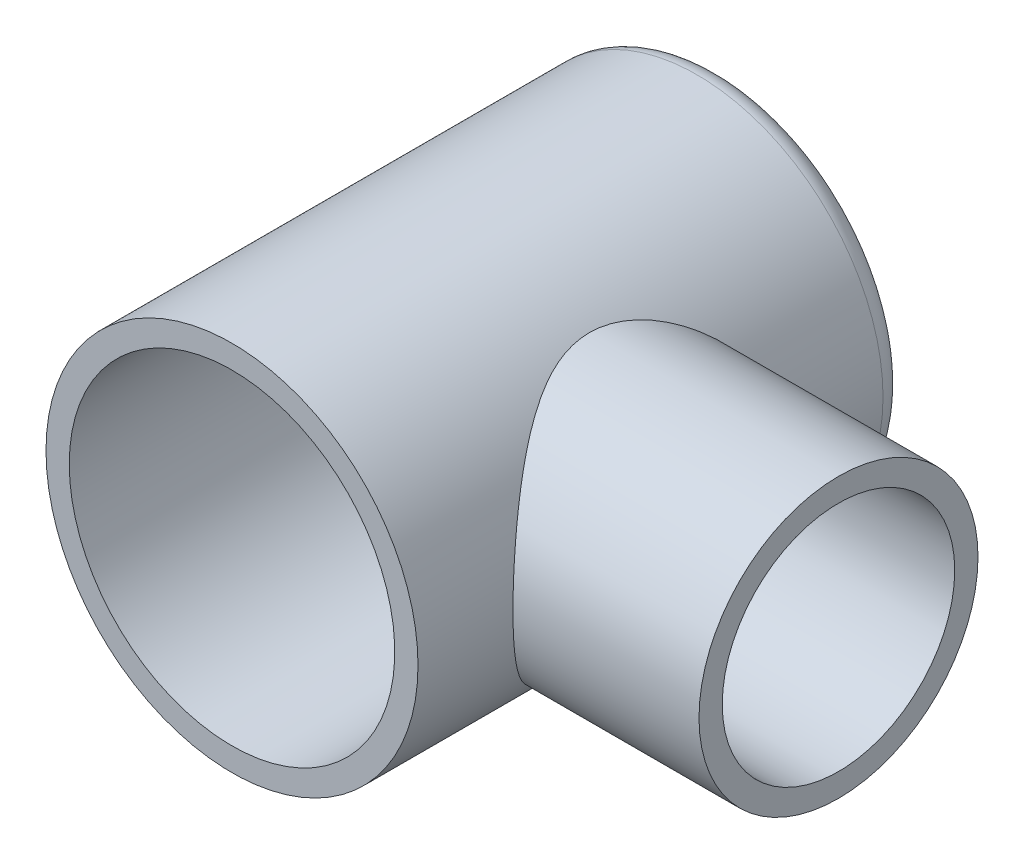
from build123d import *

# Parameters (mm, degrees)
SKETCH2_R                = 4
SKETCH2_R_2              = 3.5
BOSS_EXTRUDE1_DEPTH      = 10
BOSS_EXTRUDE2_REACH      = 15.601
BOSS_EXTRUDE2_END_RADIUS = 4
SKETCH3_R                = 3
SKETCH3_R_2              = 2.5
SKETCH4_R                = 4
BOSS_EXTRUDE3_DEPTH      = 0.5
FILLET2_R                = 0.5


with BuildPart() as part:
    # Sketch2 → Boss-Extrude1 (new body)
    with BuildSketch(Plane.XY.offset(8)):
        Circle(SKETCH2_R)
        Circle(SKETCH2_R_2, mode=Mode.SUBTRACT)
    extrude(amount=BOSS_EXTRUDE1_DEPTH)


with BuildPart() as body_2:
    # Mirror2: mirrored copy
    add(part.part.mirror(Plane.XY.offset(8)))

    # Boss-Extrude2: up to this cylinder (the profile starts outside it)
    boss_extrude2_end = Plane(origin=(0, 0, 5.872578), z_dir=(0, 0, 1)) * Cylinder(BOSS_EXTRUDE2_END_RADIUS, 40.202, mode=Mode.PRIVATE)
    # Sketch3 → Boss-Extrude2 (add, up to the surface)
    with BuildSketch(Plane(origin=(8, 0, 3), x_dir=(0, 0, -1), z_dir=(1, 0, 0)), mode=Mode.PRIVATE) as boss_extrude2_sk1:
        with Locations((0.042568871, 0)):
            Circle(SKETCH3_R)
        with Locations((0.042568871, 0)):
            Circle(SKETCH3_R_2, mode=Mode.SUBTRACT)
    boss_extrude2_tool1 = extrude(boss_extrude2_sk1.sketch, amount=-BOSS_EXTRUDE2_REACH, mode=Mode.PRIVATE) - boss_extrude2_end
    add(boss_extrude2_tool1.solids().sort_by_distance((8, 0, 5.872578))[0])

    # Sketch4 → Boss-Extrude3 (add)
    with BuildSketch(Plane(origin=(0, 0, -2), x_dir=(-1, 0, 0), z_dir=(0, 0, -1))):
        Circle(SKETCH4_R)
    extrude(amount=BOSS_EXTRUDE3_DEPTH)

    # Fillet2
    fillet2_edges = [body_2.edges().sort_by_distance(p)[0] for p in [
        (4, 0, -2.5),
    ]]
    fillet(fillet2_edges, radius=FILLET2_R - 0.0001)  # a hair under: the kernel refuses the full size


solid = body_2.part
